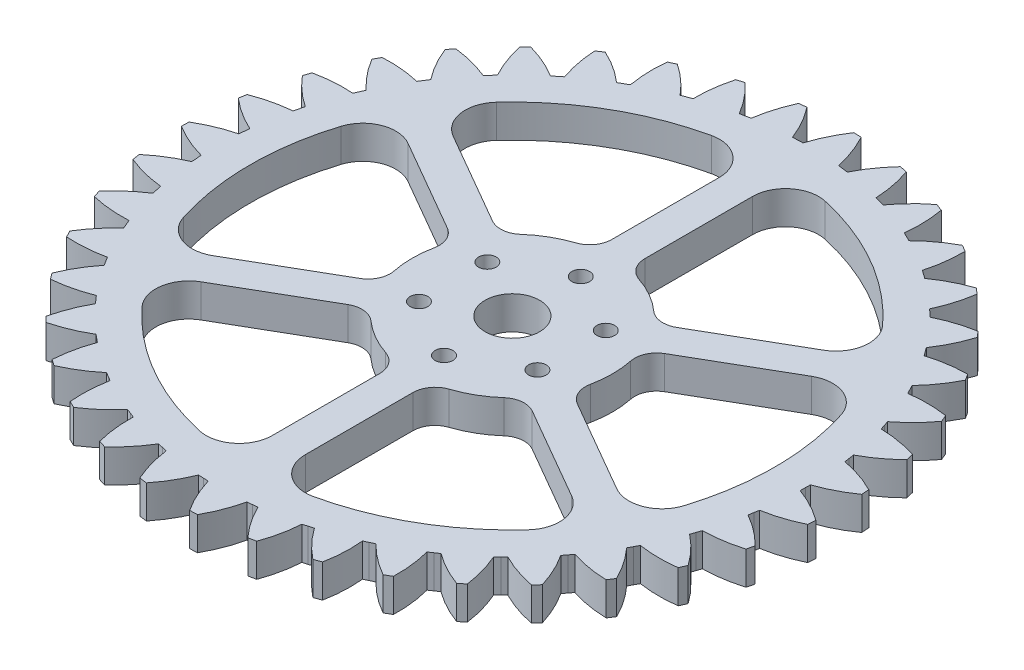
from build123d import *

# Parameters (mm, degrees)
BOSS_EXTRUDE1_DEPTH      = 1.5
CIRPATTERN2_COUNT        = 39
SKETCH3_R                = 0.8
SKETCH3_R_2              = 2.475
CUT_EXTRUDE1_DEPTH       = 43.388110201
CUT_EXTRUDE2_DEPTH       = 43.388110201
FILLET1_R                = 3
FILLET2_R                = 2
CIRPATTERN1_COUNT        = 6
FILLET1_OF_CIRPATTERN1_R = 3
FILLET2_OF_CIRPATTERN1_R = 2


with BuildPart() as part:
    # Sketch5 → Boss-Extrude1 (new, symmetric)
    with BuildSketch(Plane(origin=(0, 0, 0), x_dir=(1, 0, 0), z_dir=(0, 1, 0))):
        with BuildLine():
            Line((29.794725899, 2.521076439), (29.819813733, 2.177516055))
            Line((29.819813733, 2.177516055), (29.844901148, 1.833955641))
            ThreePointArc((29.844901148, 1.833955641), (28.363282087, 0.932985765), (26.768092937, 0.253049491))
            Line((26.768092937, 0.253049491), (26.763647744, -0.205029062))
            Line((26.763647744, -0.205029062), (0, 0))
            Line((0, 0), (26.449954509, 4.090817025))
            Line((26.449954509, 4.090817025), (26.520897753, 3.638243521))
            ThreePointArc((26.520897753, 3.638243521), (28.197939687, 3.197253599), (29.794725899, 2.521076439))
        make_face()
    boss_extrude1 = extrude(amount=BOSS_EXTRUDE1_DEPTH, both=True)

    # CirPattern2: Boss-Extrude1 ×39 about axis
    cirpattern2_axis = Axis((0, -1.5, 0), (0, 1, 0))
    for i in range(1, CIRPATTERN2_COUNT):
        add(boss_extrude1.rotate(cirpattern2_axis, i * 360 / CIRPATTERN2_COUNT))

    # Sketch3 → Cut-Extrude1 (cut, through all)
    with BuildSketch(Plane(origin=(0, 1.5, 0), x_dir=(1, 0, 0), z_dir=(0, 1, 0))):
        with Locations((-5.369357503, 3.1)):
            Circle(SKETCH3_R)
        with Locations((-5.369357503, -3.1)):
            Circle(SKETCH3_R)
        with Locations((0, -6.2)):
            Circle(SKETCH3_R)
        with Locations((5.369357503, -3.1)):
            Circle(SKETCH3_R)
        with Locations((5.369357503, 3.1)):
            Circle(SKETCH3_R)
        with Locations((0, 6.2)):
            Circle(SKETCH3_R)
        Circle(SKETCH3_R_2)
    extrude(amount=-CUT_EXTRUDE1_DEPTH, mode=Mode.SUBTRACT)

    # Sketch4 → Cut-Extrude2 (cut, through all)
    with BuildSketch(Plane(origin=(0, 1.5, 0), x_dir=(1, 0, 0), z_dir=(0, 1, 0))):
        with BuildLine():
            Line((8.508018797, 3.180056135), (21.289565422, 10.55948552))
            ThreePointArc((21.289565422, 10.55948552), (23.764434147, 0), (21.289565422, -10.55948552))
            Line((21.289565422, -10.55948552), (8.508018797, -3.180056135))
            ThreePointArc((8.508018797, -3.180056135), (9.082903769, 0), (8.508018797, 3.180056135))
        make_face()
    cut_extrude2 = extrude(amount=-CUT_EXTRUDE2_DEPTH, mode=Mode.SUBTRACT)

    # Fillet1
    fillet1_edges = [part.edges().sort_by_distance(p)[0] for p in [
        (21.289565422, 0, 10.55948552),
        (21.289565422, 0, -10.55948552),
    ]]
    fillet(fillet1_edges, radius=FILLET1_R)

    # Fillet2
    fillet2_edges = [part.edges().sort_by_distance(p)[0] for p in [
        (8.508018797, 0, 3.180056135),
        (8.508018797, 0, -3.180056135),
    ]]
    fillet(fillet2_edges, radius=FILLET2_R)

    # CirPattern1: Cut-Extrude2 ×6 about axis
    cirpattern1_axis = Axis((0, -1.5, 0), (0, 1, 0))
    for i in range(1, CIRPATTERN1_COUNT):
        add(cut_extrude2.rotate(cirpattern1_axis, i * 360 / CIRPATTERN1_COUNT), mode=Mode.SUBTRACT)

    # Fillet1 of CirPattern1
    fillet1_of_cirpattern1_edges = [part.edges().sort_by_distance(p)[0] for p in [
        (19.789565422, 0, -13.157561731),
        (1.5, 0, -23.717047251),
        (-1.5, 0, -23.717047251),
        (-19.789565422, 0, -13.157561731),
        (-21.289565422, 0, -10.55948552),
        (-21.289565422, 0, 10.55948552),
        (-19.789565422, 0, 13.157561731),
        (-1.5, 0, 23.717047251),
        (1.5, 0, 23.717047251),
        (19.789565422, 0, 13.157561731),
    ]]
    fillet(fillet1_of_cirpattern1_edges, radius=FILLET1_OF_CIRPATTERN1_R)

    # Fillet2 of CirPattern1
    fillet2_of_cirpattern1_edges = [part.edges().sort_by_distance(p)[0] for p in [
        (7.008018797, 0, -5.778132346),
        (1.5, 0, -8.958188482),
        (-1.5, 0, -8.958188482),
        (-7.008018797, 0, -5.778132346),
        (-8.508018797, 0, -3.180056135),
        (-8.508018797, 0, 3.180056135),
        (-7.008018797, 0, 5.778132346),
        (-1.5, 0, 8.958188482),
        (1.5, 0, 8.958188482),
        (7.008018797, 0, 5.778132346),
    ]]
    fillet(fillet2_of_cirpattern1_edges, radius=FILLET2_OF_CIRPATTERN1_R)


solid = part.part
